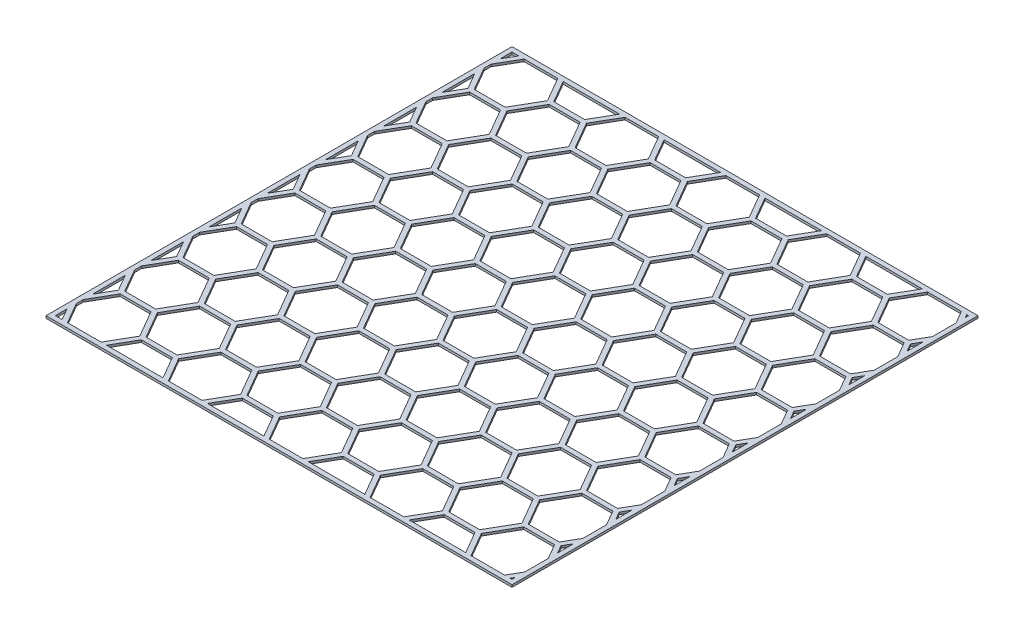
from build123d import *

# Parameters (mm, degrees)
SKETCH1_W           = 1000
SKETCH1_H           = 1000
BOSS_EXTRUDE1_DEPTH = 2.5
CUT_EXTRUDE1_DEPTH  = 708.124458635
FILL_START          = -2.5
FILL_PATTERN1_DEPTH = 5
SKETCH3_W           = 1000
SKETCH3_H           = 1000
SKETCH3_W_2         = 980
SKETCH3_H_2         = 980
BOSS_EXTRUDE2_DEPTH = 5


# Read off the part's stored shape, not the designer's step: Fill Pattern1
with BuildPart() as part:
    # Sketch1 → Boss-Extrude1 (new, symmetric)
    with BuildSketch(Plane(origin=(0, 0, 0), x_dir=(1, 0, 0), z_dir=(0, 1, 0))):
        Rectangle(SKETCH1_W, SKETCH1_H)
    extrude(amount=BOSS_EXTRUDE1_DEPTH, both=True)

    # Sketch2 → Cut-Extrude1 (cut, through all)
    with BuildSketch(Plane(origin=(0, 2.5, 0), x_dir=(1, 0, 0), z_dir=(0, 1, 0))):
        Polygon((-394.633575873, 495), (-461.02885683, 495), (-494.226497308, 437.5), (-461.02885683, 380), (-394.633575873, 380), (-361.435935394, 437.5), align=None)
    extrude(amount=-CUT_EXTRUDE1_DEPTH, mode=Mode.SUBTRACT)

    # Fill Pattern1 outline → Fill Pattern1 (cut)
    with BuildSketch(Plane(origin=(0, 0, 0), x_dir=(1, 0, 0), z_dir=(0, 1, 0)).offset(FILL_START)):
        Polygon((47.039380057, -500), (179.829941971, -500), (146.632301492, -442.5), (80.237020536, -442.5), align=None)
        Polygon((296.743371482, -442.5), (263.545731003, -500), (396.336292917, -500), (363.138652438, -442.5), align=None)
        Polygon((-169.466970889, -500), (-36.676408975, -500), (-69.874049454, -442.5), (-136.269330411, -442.5), align=None)
        Polygon((500, -465.449192431), (480.052081949, -500), (500, -500), align=None)
        Polygon((-385.973321835, -500), (-253.182759921, -500), (-286.3804004, -442.5), (-352.775681357, -442.5), align=None)
        Polygon((471.391827912, -495), (500, -445.449192431), (500, -429.550807569), (471.391827912, -380), (404.996546955, -380), (371.798906476, -437.5), (404.996546955, -495), align=None)
        Polygon((-500, -500), (-469.689110868, -500), (-500, -447.5), align=None)
        Polygon((480.052081949, -375), (500, -409.550807569), (500, -340.449192431), align=None)
        Polygon((-500, -322.5), (-500, -427.5), (-469.689110868, -375), align=None)
        Polygon((471.391827912, -370), (500, -320.449192431), (500, -304.550807569), (471.391827912, -255), (404.996546955, -255), (371.798906476, -312.5), (404.996546955, -370), align=None)
        Polygon((-500, -197.5), (-500, -302.5), (-469.689110868, -250), align=None)
        Polygon((480.052081949, -250), (500, -284.550807569), (500, -215.449192431), align=None)
        Polygon((-500, -72.5), (-500, -177.5), (-469.689110868, -125), align=None)
        Polygon((471.391827912, -245), (500, -195.449192431), (500, -179.550807569), (471.391827912, -130), (404.996546955, -130), (371.798906476, -187.5), (404.996546955, -245), align=None)
        Polygon((-500, 52.5), (-500, -52.5), (-469.689110868, 0), align=None)
        Polygon((480.052081949, -125), (500, -159.550807569), (500, -90.449192431), align=None)
        Polygon((-500, 177.5), (-500, 72.5), (-469.689110868, 125), align=None)
        Polygon((471.391827912, -120), (500, -70.449192431), (500, -54.550807569), (471.391827912, -5), (404.996546955, -5), (371.798906476, -62.5), (404.996546955, -120), align=None)
        Polygon((-500, 302.5), (-500, 197.5), (-469.689110868, 250), align=None)
        Polygon((480.052081949, 0), (500, -34.550807569), (500, 34.550807569), align=None)
        Polygon((-500, 427.5), (-500, 322.5), (-469.689110868, 375), align=None)
        Polygon((471.391827912, 5), (500, 54.550807569), (500, 70.449192431), (471.391827912, 120), (404.996546955, 120), (371.798906476, 62.5), (404.996546955, 5), align=None)
        Polygon((-500, 500), (-500, 447.5), (-469.689110868, 500), align=None)
        Polygon((480.052081949, 125), (500, 90.449192431), (500, 159.550807569), align=None)
        Polygon((-253.182759921, 500), (-385.973321835, 500), (-352.775681357, 442.5), (-286.3804004, 442.5), align=None)
        Polygon((471.391827912, 130), (500, 179.550807569), (500, 195.449192431), (471.391827912, 245), (404.996546955, 245), (371.798906476, 187.5), (404.996546955, 130), align=None)
        Polygon((-36.676408975, 500), (-169.466970889, 500), (-136.269330411, 442.5), (-69.874049454, 442.5), align=None)
        Polygon((480.052081949, 250), (500, 215.449192431), (500, 284.550807569), align=None)
        Polygon((179.829941971, 500), (47.039380057, 500), (80.237020536, 442.5), (146.632301492, 442.5), align=None)
        Polygon((471.391827912, 255), (500, 304.550807569), (500, 320.449192431), (471.391827912, 370), (404.996546955, 370), (371.798906476, 312.5), (404.996546955, 255), align=None)
        Polygon((396.336292917, 500), (263.545731003, 500), (296.743371482, 442.5), (363.138652438, 442.5), align=None)
        Polygon((480.052081949, 375), (500, 340.449192431), (500, 409.550807569), align=None)
        Polygon((500, 500), (480.052081949, 500), (500, 465.449192431), align=None)
        Polygon((471.391827912, 380), (500, 429.550807569), (500, 445.449192431), (471.391827912, 495), (404.996546955, 495), (371.798906476, 437.5), (404.996546955, 380), align=None)
        Polygon((-69.874049454, -182.5), (-36.676408975, -125), (-69.874049454, -67.5), (-136.269330411, -67.5), (-169.466970889, -125), (-136.269330411, -182.5), align=None)
        Polygon((38.379126019, -370), (71.576766498, -312.5), (38.379126019, -255), (-28.016154937, -255), (-61.213795416, -312.5), (-28.016154937, -370), align=None)
        Polygon((-178.127224927, 5), (-144.929584448, 62.5), (-178.127224927, 120), (-244.522505884, 120), (-277.720146362, 62.5), (-244.522505884, 5), align=None)
        Polygon((-286.3804004, 192.5), (-253.182759921, 250), (-286.3804004, 307.5), (-352.775681357, 307.5), (-385.973321835, 250), (-352.775681357, 192.5), align=None)
        Polygon((-277.720146362, 437.5), (-244.522505884, 380), (-178.127224927, 380), (-144.929584448, 437.5), (-178.127224927, 495), (-244.522505884, 495), align=None)
        Polygon((155.29255553, 437.5), (188.490196009, 380), (254.885476965, 380), (288.083117444, 437.5), (254.885476965, 495), (188.490196009, 495), align=None)
        Polygon((-61.213795416, 437.5), (-28.016154937, 380), (38.379126019, 380), (71.576766498, 437.5), (38.379126019, 495), (-28.016154937, 495), align=None)
        Polygon((-178.127224927, -370), (-144.929584448, -312.5), (-178.127224927, -255), (-244.522505884, -255), (-277.720146362, -312.5), (-244.522505884, -370), align=None)
        Polygon((-286.3804004, -182.5), (-253.182759921, -125), (-286.3804004, -67.5), (-352.775681357, -67.5), (-385.973321835, -125), (-352.775681357, -182.5), align=None)
        Polygon((-394.633575873, 5), (-361.435935394, 62.5), (-394.633575873, 120), (-461.02885683, 120), (-494.226497308, 62.5), (-461.02885683, 5), align=None)
        Polygon((80.237020536, 192.5), (146.632301492, 192.5), (179.829941971, 250), (146.632301492, 307.5), (80.237020536, 307.5), (47.039380057, 250), align=None)
        Polygon((-28.016154937, 5), (38.379126019, 5), (71.576766498, 62.5), (38.379126019, 120), (-28.016154937, 120), (-61.213795416, 62.5), align=None)
        Polygon((-494.226497308, -312.5), (-461.02885683, -370), (-394.633575873, -370), (-361.435935394, -312.5), (-394.633575873, -255), (-461.02885683, -255), align=None)
        Polygon((155.29255553, -312.5), (188.490196009, -370), (254.885476965, -370), (288.083117444, -312.5), (254.885476965, -255), (188.490196009, -255), align=None)
        Polygon((-286.3804004, -307.5), (-253.182759921, -250), (-286.3804004, -192.5), (-352.775681357, -192.5), (-385.973321835, -250), (-352.775681357, -307.5), align=None)
        Polygon((-178.127224927, -495), (-144.929584448, -437.5), (-178.127224927, -380), (-244.522505884, -380), (-277.720146362, -437.5), (-244.522505884, -495), align=None)
        Polygon((-394.633575873, -120), (-361.435935394, -62.5), (-394.633575873, -5), (-461.02885683, -5), (-494.226497308, -62.5), (-461.02885683, -120), align=None)
        Polygon((-244.522505884, -120), (-178.127224927, -120), (-144.929584448, -62.5), (-178.127224927, -5), (-244.522505884, -5), (-277.720146362, -62.5), align=None)
        Polygon((-461.02885683, -495), (-394.633575873, -495), (-361.435935394, -437.5), (-394.633575873, -380), (-461.02885683, -380), (-494.226497308, -437.5), align=None)
        Polygon((-28.016154937, 255), (38.379126019, 255), (71.576766498, 312.5), (38.379126019, 370), (-28.016154937, 370), (-61.213795416, 312.5), align=None)
        Polygon((-136.269330411, 67.5), (-69.874049454, 67.5), (-36.676408975, 125), (-69.874049454, 182.5), (-136.269330411, 182.5), (-169.466970889, 125), align=None)
        Polygon((47.039380057, -250), (80.237020536, -307.5), (146.632301492, -307.5), (179.829941971, -250), (146.632301492, -192.5), (80.237020536, -192.5), align=None)
        Polygon((-169.466970889, -250), (-136.269330411, -307.5), (-69.874049454, -307.5), (-36.676408975, -250), (-69.874049454, -192.5), (-136.269330411, -192.5), align=None)
        Polygon((263.545731003, -250), (296.743371482, -307.5), (363.138652438, -307.5), (396.336292917, -250), (363.138652438, -192.5), (296.743371482, -192.5), align=None)
        Polygon((38.379126019, -495), (71.576766498, -437.5), (38.379126019, -380), (-28.016154937, -380), (-61.213795416, -437.5), (-28.016154937, -495), align=None)
        Polygon((-286.3804004, 67.5), (-253.182759921, 125), (-286.3804004, 182.5), (-352.775681357, 182.5), (-385.973321835, 125), (-352.775681357, 67.5), align=None)
        Polygon((-394.633575873, 255), (-361.435935394, 312.5), (-394.633575873, 370), (-461.02885683, 370), (-494.226497308, 312.5), (-461.02885683, 255), align=None)
        Polygon((296.743371482, 67.5), (363.138652438, 67.5), (396.336292917, 125), (363.138652438, 182.5), (296.743371482, 182.5), (263.545731003, 125), align=None)
        Polygon((188.490196009, -120), (254.885476965, -120), (288.083117444, -62.5), (254.885476965, -5), (188.490196009, -5), (155.29255553, -62.5), align=None)
        Polygon((155.29255553, -437.5), (188.490196009, -495), (254.885476965, -495), (288.083117444, -437.5), (254.885476965, -380), (188.490196009, -380), align=None)
        Polygon((-69.874049454, -432.5), (-36.676408975, -375), (-69.874049454, -317.5), (-136.269330411, -317.5), (-169.466970889, -375), (-136.269330411, -432.5), align=None)
        Polygon((-178.127224927, -245), (-144.929584448, -187.5), (-178.127224927, -130), (-244.522505884, -130), (-277.720146362, -187.5), (-244.522505884, -245), align=None)
        Polygon((-394.633575873, 130), (-361.435935394, 187.5), (-394.633575873, 245), (-461.02885683, 245), (-494.226497308, 187.5), (-461.02885683, 130), align=None)
        Polygon((-286.3804004, -57.5), (-253.182759921, 0), (-286.3804004, 57.5), (-352.775681357, 57.5), (-385.973321835, 0), (-352.775681357, -57.5), align=None)
        Polygon((-28.016154937, -245), (38.379126019, -245), (71.576766498, -187.5), (38.379126019, -130), (-28.016154937, -130), (-61.213795416, -187.5), align=None)
        Polygon((188.490196009, 130), (254.885476965, 130), (288.083117444, 187.5), (254.885476965, 245), (188.490196009, 245), (155.29255553, 187.5), align=None)
        Polygon((296.743371482, 317.5), (363.138652438, 317.5), (396.336292917, 375), (363.138652438, 432.5), (296.743371482, 432.5), (263.545731003, 375), align=None)
        Polygon((80.237020536, -57.5), (146.632301492, -57.5), (179.829941971, 0), (146.632301492, 57.5), (80.237020536, 57.5), (47.039380057, 0), align=None)
        Polygon((-385.973321835, -375), (-352.775681357, -432.5), (-286.3804004, -432.5), (-253.182759921, -375), (-286.3804004, -317.5), (-352.775681357, -317.5), align=None)
        Polygon((263.545731003, -375), (296.743371482, -432.5), (363.138652438, -432.5), (396.336292917, -375), (363.138652438, -317.5), (296.743371482, -317.5), align=None)
        Polygon((47.039380057, -375), (80.237020536, -432.5), (146.632301492, -432.5), (179.829941971, -375), (146.632301492, -317.5), (80.237020536, -317.5), align=None)
        Polygon((-394.633575873, -245), (-361.435935394, -187.5), (-394.633575873, -130), (-461.02885683, -130), (-494.226497308, -187.5), (-461.02885683, -245), align=None)
        Polygon((-136.269330411, 317.5), (-69.874049454, 317.5), (-36.676408975, 375), (-69.874049454, 432.5), (-136.269330411, 432.5), (-169.466970889, 375), align=None)
        Polygon((-244.522505884, 130), (-178.127224927, 130), (-144.929584448, 187.5), (-178.127224927, 245), (-244.522505884, 245), (-277.720146362, 187.5), align=None)
        Polygon((155.29255553, -187.5), (188.490196009, -245), (254.885476965, -245), (288.083117444, -187.5), (254.885476965, -130), (188.490196009, -130), align=None)
        Polygon((146.632301492, -182.5), (179.829941971, -125), (146.632301492, -67.5), (80.237020536, -67.5), (47.039380057, -125), (80.237020536, -182.5), align=None)
        Polygon((-69.874049454, 192.5), (-36.676408975, 250), (-69.874049454, 307.5), (-136.269330411, 307.5), (-169.466970889, 250), (-136.269330411, 192.5), align=None)
        Polygon((188.490196009, 255), (254.885476965, 255), (288.083117444, 312.5), (254.885476965, 370), (188.490196009, 370), (155.29255553, 312.5), align=None)
        Polygon((-28.016154937, -120), (38.379126019, -120), (71.576766498, -62.5), (38.379126019, -5), (-28.016154937, -5), (-61.213795416, -62.5), align=None)
        Polygon((80.237020536, 67.5), (146.632301492, 67.5), (179.829941971, 125), (146.632301492, 182.5), (80.237020536, 182.5), (47.039380057, 125), align=None)
        Polygon((80.237020536, 317.5), (146.632301492, 317.5), (179.829941971, 375), (146.632301492, 432.5), (80.237020536, 432.5), (47.039380057, 375), align=None)
        Polygon((-136.269330411, -57.5), (-69.874049454, -57.5), (-36.676408975, 0), (-69.874049454, 57.5), (-136.269330411, 57.5), (-169.466970889, 0), align=None)
        Polygon((-28.016154937, 130), (38.379126019, 130), (71.576766498, 187.5), (38.379126019, 245), (-28.016154937, 245), (-61.213795416, 187.5), align=None)
        Polygon((363.138652438, 307.5), (296.743371482, 307.5), (263.545731003, 250), (296.743371482, 192.5), (363.138652438, 192.5), (396.336292917, 250), align=None)
        Polygon((254.885476965, 120), (188.490196009, 120), (155.29255553, 62.5), (188.490196009, 5), (254.885476965, 5), (288.083117444, 62.5), align=None)
        Polygon((-244.522505884, 255), (-178.127224927, 255), (-144.929584448, 312.5), (-178.127224927, 370), (-244.522505884, 370), (-277.720146362, 312.5), align=None)
        Polygon((363.138652438, -67.5), (296.743371482, -67.5), (263.545731003, -125), (296.743371482, -182.5), (363.138652438, -182.5), (396.336292917, -125), align=None)
        Polygon((-286.3804004, 317.5), (-253.182759921, 375), (-286.3804004, 432.5), (-352.775681357, 432.5), (-385.973321835, 375), (-352.775681357, 317.5), align=None)
        Polygon((296.743371482, -57.5), (363.138652438, -57.5), (396.336292917, 0), (363.138652438, 57.5), (296.743371482, 57.5), (263.545731003, 0), align=None)
    extrude(amount=FILL_PATTERN1_DEPTH, mode=Mode.SUBTRACT)

    # Sketch3 → Boss-Extrude2 (add)
    with BuildSketch(Plane(origin=(0, 2.5, 0), x_dir=(1, 0, 0), z_dir=(0, 1, 0))):
        Rectangle(SKETCH3_W, SKETCH3_H)
        Rectangle(SKETCH3_W_2, SKETCH3_H_2, mode=Mode.SUBTRACT)
    extrude(amount=-BOSS_EXTRUDE2_DEPTH)


solid = part.part
